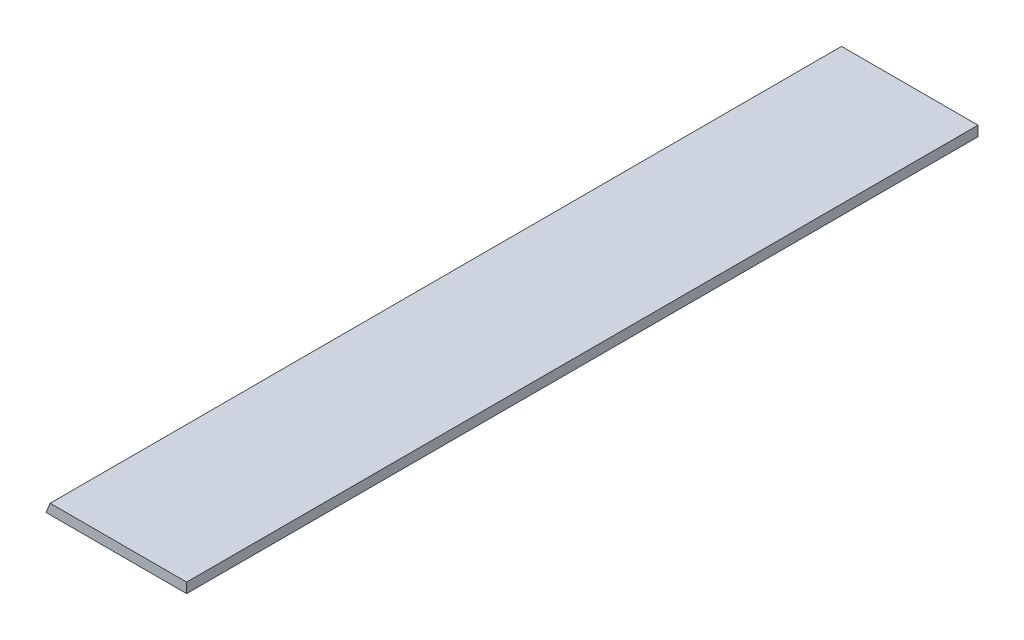
from build123d import *

# Parameters (mm, degrees)
BOSS_EXTRUDE1_DEPTH = 501.65


with BuildPart() as part:
    # Sketch1 → Boss-Extrude1 (new body)
    with BuildSketch(Plane.XY):
        Polygon((0, 0), (2.630256121, 6.35), (89.154, 6.35), (89.154, 0), align=None)
    extrude(amount=BOSS_EXTRUDE1_DEPTH)


solid = part.part
